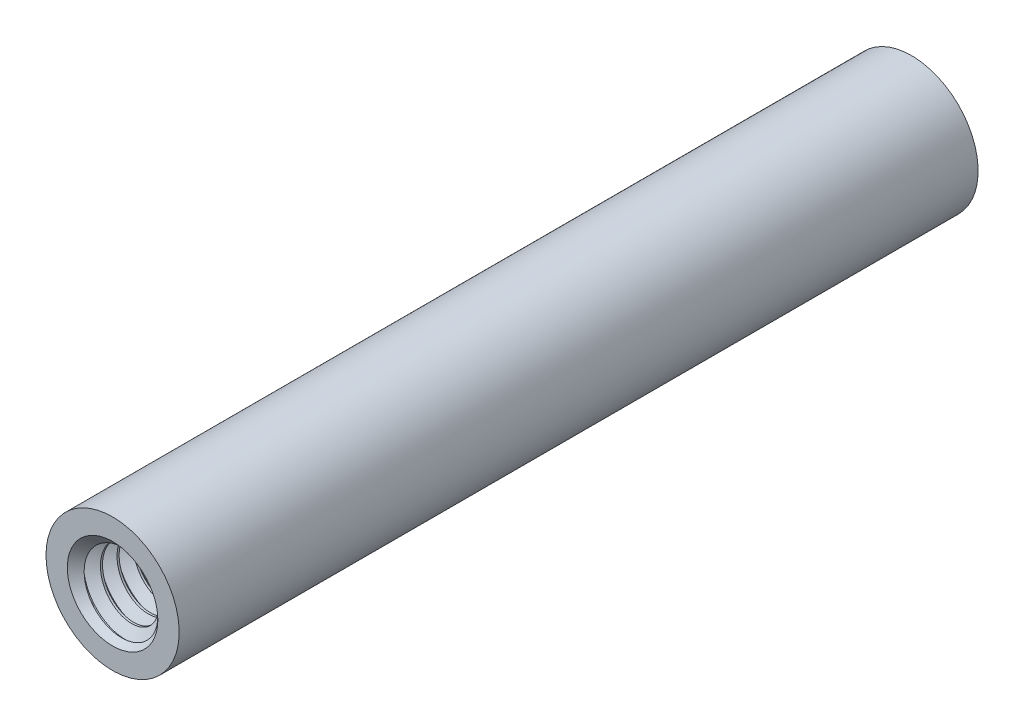
from build123d import *

# Parameters (mm, degrees)
BOSS_EXTRUDE1_START = 19.05
SKETCH13_R          = 2.0828
BOSS_EXTRUDE1_DEPTH = 11.1125
CUT_SWEEP1_PITCH    = 0.79375
CIRPATTERN1_COUNT   = 2
CIRPATTERN1_ANGLE   = 180
EXTRUDE1_DEPTH      = 19.05
EXTRUDE1_DEPTH_BACK = 19.05
SKETCH1_R           = 3.175


with BuildPart() as part:
    # Sketch13 → Boss-Extrude1 (new body)
    with BuildSketch(Plane.XY.offset(BOSS_EXTRUDE1_START)):
        Circle(SKETCH13_R)
    extrude(amount=-BOSS_EXTRUDE1_DEPTH)

    # Cut-Sweep1: the profile of Sketch15 profile screwed along a right-hand helix of 15 turns, 8 arcs to a turn; built about Z, then put on its axis
    cut_sweep1_z = Axis((0, 0, 0), (0, 0, 1))
    cut_sweep1_corners = [(2.0831, 0, -0.694704455), (2.0831, 0, 0.000173205), (1.567244252, 0, -0.29765625), (1.567244252, 0, -0.396875)]
    with BuildLine(mode=Mode.PRIVATE) as cut_sweep1_profile:
        Line(cut_sweep1_corners[0], cut_sweep1_corners[1])
        Line(cut_sweep1_corners[1], cut_sweep1_corners[2])
        Line(cut_sweep1_corners[2], cut_sweep1_corners[3])
        Line(cut_sweep1_corners[3], cut_sweep1_corners[0])
    cut_sweep1_cap = Face(cut_sweep1_profile.wire())
    cut_sweep1_turn_angles = [0, 22.5, 45, 67.5, 90, 112.5, 135, 157.5, 180, 202.5, 225, 247.5, 270, 292.5, 315, 337.5, 360]
    cut_sweep1_turn_weights = [1, 0.9238795325112867, 1, 0.9238795325112867, 1, 0.9238795325112867, 1, 0.9238795325112867, 1, 0.9238795325112867, 1, 0.9238795325112867, 1, 0.9238795325112867, 1, 0.9238795325112867, 1]
    cut_sweep1_turn_rails = [Edge.make_bspline([Vector(p[0], p[1], 0).rotate(cut_sweep1_z, cut_sweep1_turn_angles[k]) / cut_sweep1_turn_weights[k] + Vector(0, 0, p[2] + CUT_SWEEP1_PITCH * cut_sweep1_turn_angles[k] / 360) for k in range(17)], [0, 0, 0, 1, 1, 2, 2, 3, 3, 4, 4, 5, 5, 6, 6, 7, 7, 8, 8, 8], 2, cut_sweep1_turn_weights) for p in cut_sweep1_corners]
    cut_sweep1_turn_sides = [Face.make_surface_from_curves(cut_sweep1_turn_rails[p[0]], cut_sweep1_turn_rails[p[1]]) for p in [(0, 1), (1, 2), (2, 3), (3, 0)]]
    cut_sweep1 = Plane(origin=(0, 0, 19.05), x_dir=(0, 1, 0), z_dir=(0, 0, -1)) * Solid(Shell([*[p.moved(Location((0, 0, CUT_SWEEP1_PITCH * i))) for i in range(15) for p in cut_sweep1_turn_sides], cut_sweep1_cap, cut_sweep1_cap.rotate(cut_sweep1_z, 5400).moved(Location((0, 0, CUT_SWEEP1_PITCH * 5400 / 360)))]))
    add(cut_sweep1, mode=Mode.SUBTRACT)

    # Boss-Extrude2 cone 1 section (through the dimple's axis) → Boss-Extrude2 (revolve)
    with BuildSketch(Plane(origin=(0, 0, 19.05), x_dir=(0, -1, 0), z_dir=(1, 0, 0))):
        Polygon((0, 0), (2.159, 0), (0, 2.159), align=None)
    revolve(axis=Axis((0, 0, 19.05), (0, 0, -1)))


with BuildPart() as cirpattern1_1:
    # CirPattern1: pattern copy
    add(part.part.rotate(Axis((0, 3.175, 0), (0, -1, 0)), 1 * CIRPATTERN1_ANGLE / (CIRPATTERN1_COUNT - 1)))


with BuildPart() as body_3:
    # Sketch1 → Extrude1 (new, two sides: drawn at the far end of the back side and taken through both)
    with BuildSketch(Plane.XY.offset(-EXTRUDE1_DEPTH_BACK)):
        with Locations(Location((0, 0, 0), (0, 0, 180))):
            Circle(SKETCH1_R)
    extrude(amount=EXTRUDE1_DEPTH + EXTRUDE1_DEPTH_BACK)

    # Combine1: cut CirPattern1_1, part
    add(cirpattern1_1.part, mode=Mode.SUBTRACT)
    add(part.part, mode=Mode.SUBTRACT)


solid = body_3.part
